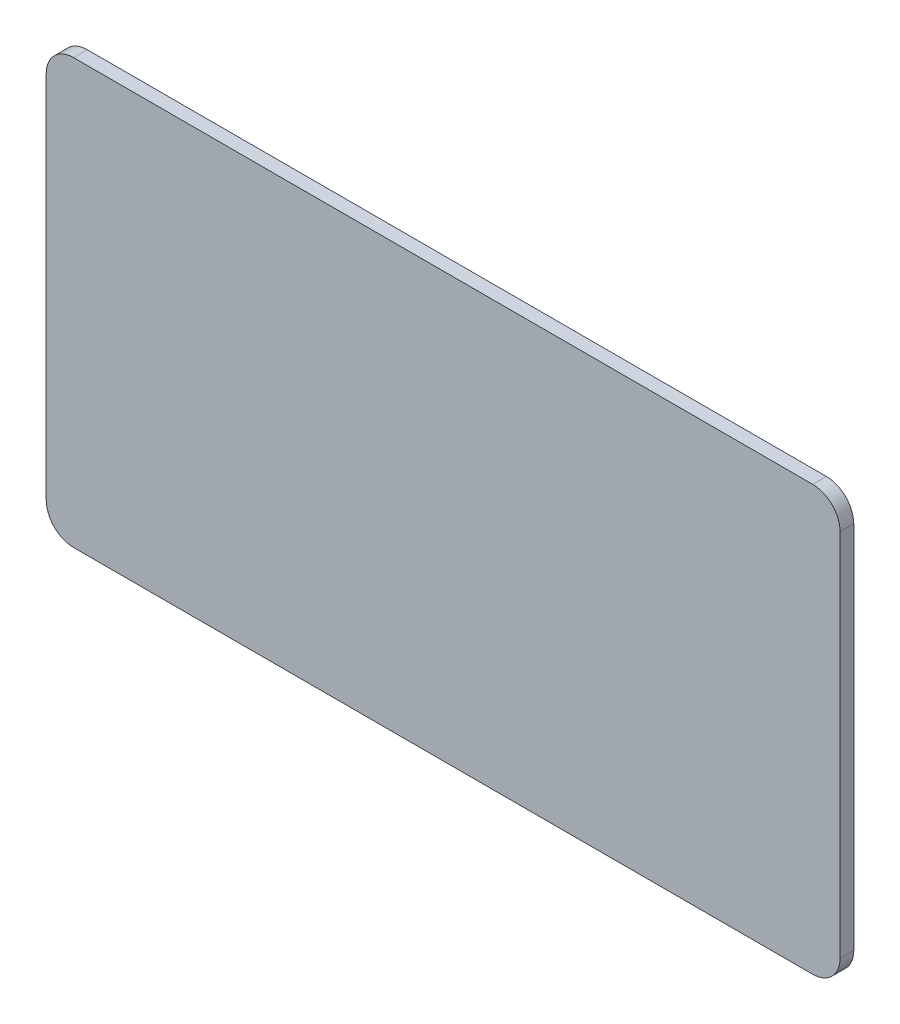
from build123d import *

# Parameters (mm, degrees)
BOSS_EXTRUDE1_DEPTH = 5


with BuildPart() as part:
    # Sketch1 → Boss-Extrude1 (new body)
    with BuildSketch(Plane.XY):
        with BuildLine():
            Line((10, 0), (280, 0))
            ThreePointArc((280, 0), (287.071067812, 2.928932188), (290, 10))
            Line((290, 10), (290, 145))
            ThreePointArc((290, 145), (287.071067812, 152.071067812), (280, 155))
            Line((280, 155), (10, 155))
            ThreePointArc((10, 155), (2.928932188, 152.071067812), (0, 145))
            Line((0, 145), (0, 10))
            ThreePointArc((0, 10), (2.928932188, 2.928932188), (10, 0))
        make_face()
    extrude(amount=BOSS_EXTRUDE1_DEPTH)


solid = part.part
